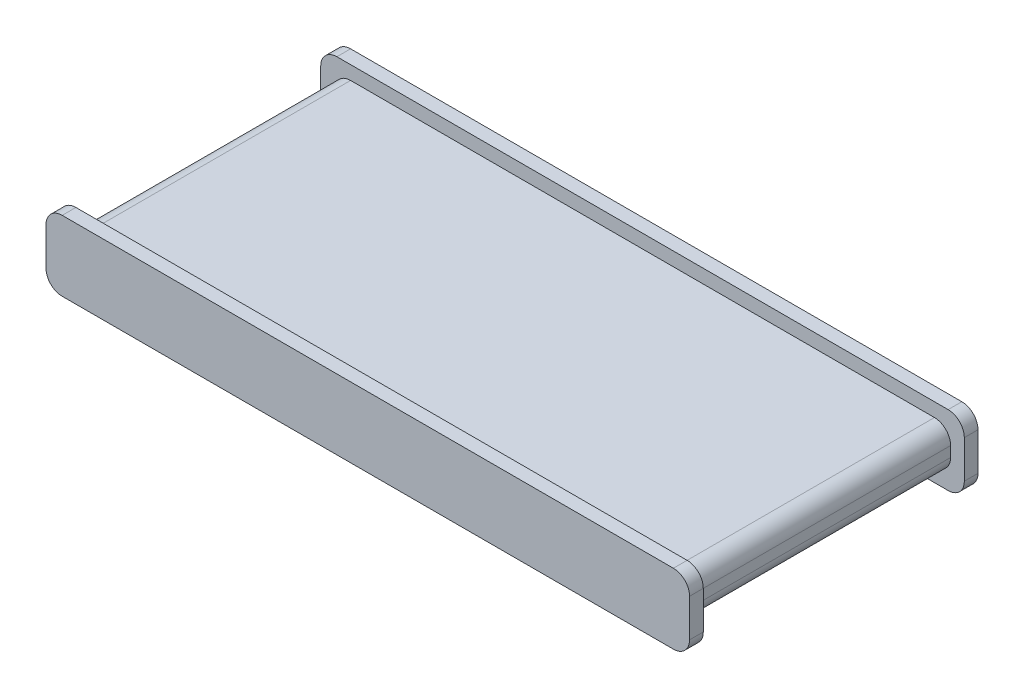
from build123d import *

# Parameters (mm, degrees)
SKETCH2_W           = 114.3
SKETCH2_H           = 7.924066875
BOSS_EXTRUDE1_DEPTH = 48.42
FILLET1_R           = 3
SKETCH3_W           = 119.38
SKETCH3_H           = 13.004066875
BOSS_EXTRUDE2_DEPTH = 2.54
SKETCH4_W           = 119.38
SKETCH4_H           = 13.004066875
BOSS_EXTRUDE3_DEPTH = 2.54
FILLET2_R           = 3


with BuildPart() as part:
    # Sketch2 → Boss-Extrude1 (new body)
    with BuildSketch(Plane.XY):
        with Locations((57.15, 3.962033438)):
            Rectangle(SKETCH2_W, SKETCH2_H)
    extrude(amount=BOSS_EXTRUDE1_DEPTH)

    # Fillet1
    fillet1_edges = [part.edges().sort_by_distance(p)[0] for p in [
        (114.3, 7.924066875, 24.21),
        (114.3, 0, 24.21),
        (0, 7.924066875, 24.21),
        (0, 0, 24.21),
    ]]
    fillet(fillet1_edges, radius=FILLET1_R)

    # Sketch3 → Boss-Extrude2 (add)
    with BuildSketch(Plane.XY.offset(48.42)):
        with Locations((57.15, 3.962033438)):
            Rectangle(SKETCH3_W, SKETCH3_H)
    extrude(amount=BOSS_EXTRUDE2_DEPTH)

    # Sketch4 → Boss-Extrude3 (add)
    with BuildSketch(Plane(origin=(0, 0, 0), x_dir=(-1, 0, 0), z_dir=(0, 0, -1))):
        with Locations((-57.15, 3.962033438)):
            Rectangle(SKETCH4_W, SKETCH4_H)
    extrude(amount=BOSS_EXTRUDE3_DEPTH)

    # Fillet2
    fillet2_edges = [part.edges().sort_by_distance(p)[0] for p in [
        (-2.54, -2.54, -1.27),
        (-2.54, 10.464066875, -1.27),
        (116.84, 10.464066875, -1.27),
        (116.84, -2.54, -1.27),
        (116.84, 10.464066875, 49.69),
        (116.84, -2.54, 49.69),
        (-2.54, 10.464066875, 49.69),
        (-2.54, -2.54, 49.69),
    ]]
    fillet(fillet2_edges, radius=FILLET2_R)


solid = part.part
